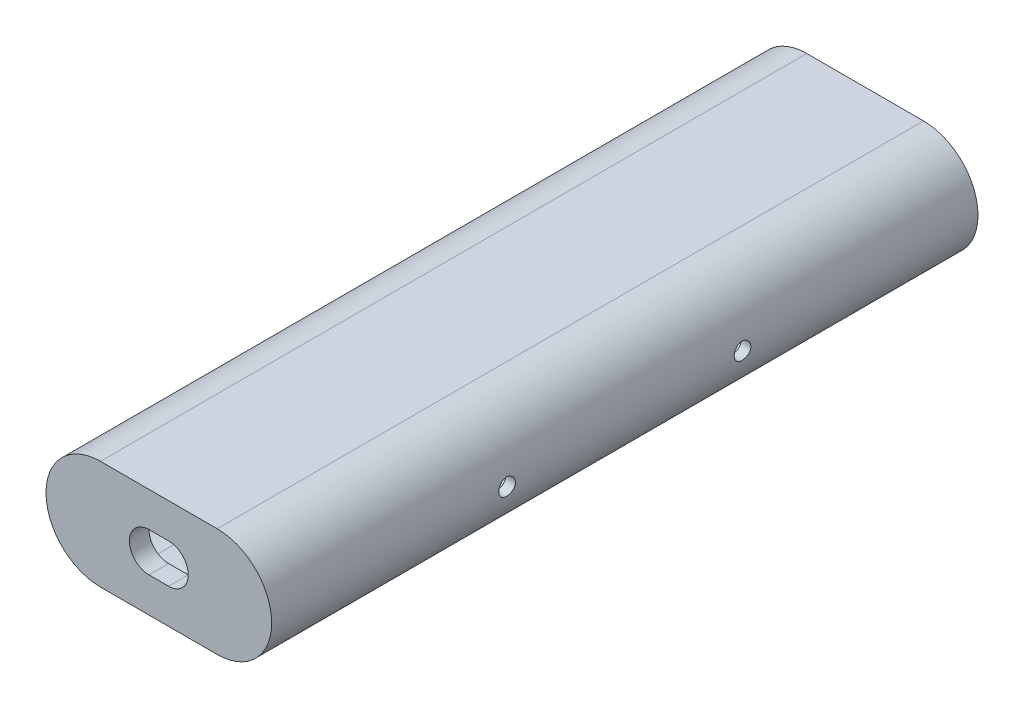
from build123d import *
from build123d.topology import SkipClean

# Parameters (mm, degrees)
BOSS_EXTRUDE1_DEPTH     = 177.8
BOSS_EXTRUDE2_START     = 5.08
BOSS_EXTRUDE2_DEPTH     = 5.08
CUT_EXTRUDE5_DEPTH      = 5.08
CUT_EXTRUDE6_START      = -30
CUT_EXTRUDE6_OUTLINE_R  = 3.683
CUT_EXTRUDE6_DEPTH      = 56.067449815
CUT_EXTRUDE6_START_2    = -120.5230001
CUT_EXTRUDE6_2_DEPTH    = 7.3660001
CUT_EXTRUDE6_START_3    = -59.563
CUT_EXTRUDE6_3_DEPTH    = 7.366
CUT_EXTRUDE6_START_4    = 26.067441172
CUT_EXTRUDE6_4_DEPTH    = 1.932558828
CUT_EXTRUDE7_DEPTH      = 40.64
CUT_EXTRUDE7_DEPTH_BACK = 40.64
SKETCH9_R               = 2.159


with BuildPart() as part:
    # Sketch1 → Boss-Extrude1 (new body)
    with BuildSketch(Plane.XY):
        with BuildLine():
            ThreePointArc((-24.13, 0), (-20.74503307, 8.17203307), (-12.573, 11.557))
            Line((-12.573, 11.557), (12.573, 11.557))
            ThreePointArc((12.573, 11.557), (20.74503307, 8.17203307), (24.13, 0))
            Line((24.13, 0), (29.21, 0))
            ThreePointArc((29.21, 0), (25.081084294, 9.968084294), (15.113, 14.097))
            Line((15.113, 14.097), (-15.113, 14.097))
            ThreePointArc((-15.113, 14.097), (-25.081084294, 9.968084294), (-29.21, 0))
            Line((-29.21, 0), (-24.13, 0))
        make_face()
        with BuildLine():
            ThreePointArc((-12.573, -11.557), (-20.74503307, -8.17203307), (-24.13, 0))
            Line((-24.13, 0), (-29.21, 0))
            ThreePointArc((-29.21, 0), (-25.081084294, -9.968084294), (-15.113, -14.097))
            Line((-15.113, -14.097), (15.113, -14.097))
            ThreePointArc((15.113, -14.097), (25.081084294, -9.968084294), (29.21, 0))
            Line((29.21, 0), (24.13, 0))
            ThreePointArc((24.13, 0), (20.74503307, -8.17203307), (12.573, -11.557))
            Line((12.573, -11.557), (-12.573, -11.557))
        make_face()
    extrude(amount=-BOSS_EXTRUDE1_DEPTH)

    # Sketch3 → Boss-Extrude2 (add)
    with BuildSketch(Plane.XY.offset(BOSS_EXTRUDE2_START)):
        with BuildLine():
            Line((-15.113, 14.097), (15.113, 14.097))
            ThreePointArc((15.113, 14.097), (29.21, 0), (15.113, -14.097))
            Line((15.113, -14.097), (-15.113, -14.097))
            ThreePointArc((-15.113, -14.097), (-29.21, 0), (-15.113, 14.097))
        make_face()
    extrude(amount=-BOSS_EXTRUDE2_DEPTH)

    # Sketch7 → Cut-Extrude5 (cut)
    with BuildSketch(Plane.XY.offset(5.08)):
        with BuildLine():
            Line((-2.54, 5.08), (2.54, 5.08))
            ThreePointArc((2.54, 5.08), (7.62, 0), (2.54, -5.08))
            Line((2.54, -5.08), (-2.54, -5.08))
            ThreePointArc((-2.54, -5.08), (-7.62, 0), (-2.54, 5.08))
        make_face()
    extrude(amount=-CUT_EXTRUDE5_DEPTH, mode=Mode.SUBTRACT)

    # Cut-Extrude6: read off the stored shape, not the designer's step
    # Cut-Extrude6 outline → Cut-Extrude6 (cut)
    with SkipClean():  # the faces are left unmerged after this step: merging them gives an invalid solid
        with BuildSketch(Plane(origin=(0, 0, 0), x_dir=(0, 0, -1), z_dir=(1, 0, 0)).offset(CUT_EXTRUDE6_START)):
            with Locations((55.88, 0)):
                Circle(CUT_EXTRUDE6_OUTLINE_R)
            with Locations((116.84, 0)):
                Circle(CUT_EXTRUDE6_OUTLINE_R)
        extrude(amount=CUT_EXTRUDE6_DEPTH, mode=Mode.SUBTRACT)

    # Cut-Extrude6 2 outline → Cut-Extrude6 2 (cut)
    with SkipClean():  # the faces are left unmerged after this step: merging them gives an invalid solid
        with BuildSketch(Plane.XY.offset(CUT_EXTRUDE6_START_2)):
            with BuildLine():
                Line((26.067441172, 3.682997094), (26.067441173, -3.682997094))
                ThreePointArc((26.067441173, -3.682997094), (26.67, 0), (26.067441172, 3.682997094))
            make_face()
        extrude(amount=CUT_EXTRUDE6_2_DEPTH, mode=Mode.SUBTRACT)

    # Cut-Extrude6 3 outline → Cut-Extrude6 3 (cut)
    with SkipClean():  # the faces are left unmerged after this step: merging them gives an invalid solid
        with BuildSketch(Plane.XY.offset(CUT_EXTRUDE6_START_3)):
            with BuildLine():
                Line((26.067441172, 3.682997094), (26.067441173, -3.682997094))
                ThreePointArc((26.067441173, -3.682997094), (26.67, 0), (26.067441172, 3.682997094))
            make_face()
        extrude(amount=CUT_EXTRUDE6_3_DEPTH, mode=Mode.SUBTRACT)

    # Cut-Extrude6 4 outline → Cut-Extrude6 4 (add)
    with SkipClean():  # the faces are left unmerged after this step: merging them gives an invalid solid
        with BuildSketch(Plane.YZ.offset(CUT_EXTRUDE6_START_4)):
            with BuildLine():
                ThreePointArc((0, -52.197), (3.683, -55.88), (0, -59.563))
                Line((0, -59.563), (5, -59.563))
                Line((5, -59.563), (5, -52.197))
                Line((5, -52.197), (0, -52.197))
            make_face()
            with BuildLine():
                ThreePointArc((0, -59.563), (-3.683, -55.88), (0, -52.197))
                Line((0, -52.197), (-5, -52.197))
                Line((-5, -52.197), (-5, -59.563))
                Line((-5, -59.563), (0, -59.563))
            make_face()
            with BuildLine():
                Line((5, -120.5230001), (5, -113.157))
                Line((5, -113.157), (6.9e-08, -113.157))
                ThreePointArc((6.9e-08, -113.157), (3.683, -116.840000034), (0, -120.523))
                Line((0, -120.523), (5, -120.5230001))
            make_face()
            with BuildLine():
                Line((6.9e-08, -113.157), (-5, -113.157))
                Line((-5, -113.157), (-5, -120.5230001))
                Line((-5, -120.5230001), (0, -120.523))
                ThreePointArc((0, -120.523), (-3.683, -116.839999966), (6.9e-08, -113.157))
            make_face()
        extrude(amount=CUT_EXTRUDE6_4_DEPTH)

    # Sketch9 → Cut-Extrude7 (cut, two sides: drawn at the far end of the back side and taken through both)
    with SkipClean():  # the faces are left unmerged after this step: merging them gives an invalid solid
        with BuildSketch(Plane(origin=(0, 0, 0), x_dir=(0, 0, -1), z_dir=(1, 0, 0)).offset(-CUT_EXTRUDE7_DEPTH_BACK)):
            with Locations(Location((55.88, 0, 0), (0, 0, 180))):
                Circle(SKETCH9_R)
            with Locations((116.84, 0)):
                Circle(SKETCH9_R)
        extrude(amount=CUT_EXTRUDE7_DEPTH + CUT_EXTRUDE7_DEPTH_BACK, mode=Mode.SUBTRACT)


solid = part.part
